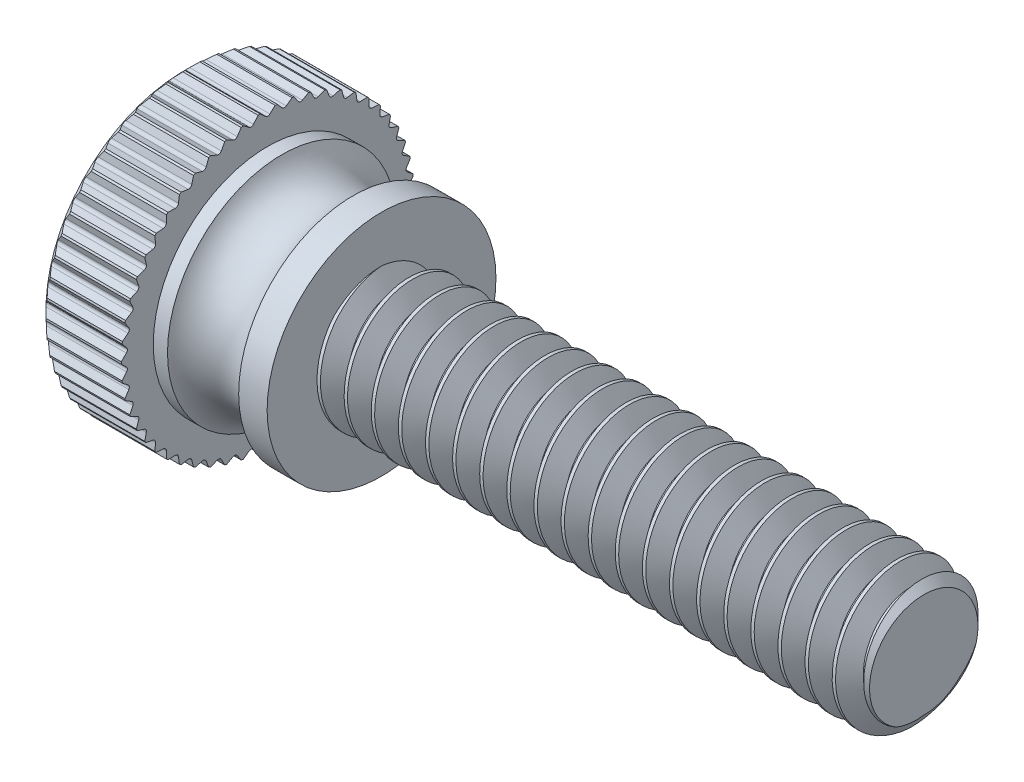
from build123d import *

# Parameters (mm, degrees)
CHAMFER1_SIZE      = 0.635
CHAMFER2_SIZE      = 0.41148
CUT_SWEEP1_PITCH   = 1.27
CUT_SWEEP1_TO      = 25.4
CUT_EXTRUDE1_DEPTH = 9.271
CIRPATTERN1_COUNT  = 54


with BuildPart() as part:
    # Sketch3 → Revolve1 (revolve)
    with BuildSketch(Plane.XY, mode=Mode.PRIVATE) as revolve1_sk:
        with BuildLine():
            Line((-9.271, 0), (-9.271, 6.858))
            Line((-9.271, 6.858), (-5.334, 6.858))
            Line((-5.334, 6.858), (-5.334, 5.3594))
            Line((-5.334, 5.3594), (-4.66725, 5.3594))
            ThreePointArc((-4.66725, 5.3594), (-3.000375, 4.28752), (-1.3335, 5.3594))
            Line((-1.3335, 5.3594), (0, 5.3594))
            Line((0, 5.3594), (0, 3.175))
            Line((0, 3.175), (25.4, 3.175))
            Line((25.4, 3.175), (25.4, 0))
            Line((25.4, 0), (-9.271, 0))
        make_face()
    revolve(revolve1_sk.sketch.rotate(Axis((0, 0, 0), (1, 0, 0)), 90), axis=Axis((0, 0, 0), (1, 0, 0)))

    # Chamfer1
    chamfer1_edges = [part.edges().sort_by_distance(p)[0] for p in [
        (25.4, 0, -3.175),
    ]]
    chamfer(chamfer1_edges, length=CHAMFER1_SIZE)

    # Chamfer2
    chamfer2_edges = [part.edges().sort_by_distance(p)[0] for p in [
        (-9.271, 0, -6.858),
    ]]
    chamfer(chamfer2_edges, length=CHAMFER2_SIZE)


with BuildPart() as body_2:
    # Split1: the piece on the far side of the plane
    add(part.part)
    split(bisect_by=Plane(origin=(0, 0, 0), x_dir=(0, 0, 1), z_dir=(1, 0, 0)), keep=Keep.BOTTOM)


with BuildPart() as part_1:
    add(part.part)

    # Split1
    split(bisect_by=Plane(origin=(0, 0, 0), x_dir=(0, 0, 1), z_dir=(1, 0, 0)), keep=Keep.TOP)

    # Cut-Sweep1: arcs per turn and ends read off the stored shape
    # Cut-Sweep1: the profile of Sketch5 screwed along a right-hand helix through 21 turns, 8 arcs to a turn; built about Z, then put on its axis
    cut_sweep1_z = Axis((0, 0, 0), (0, 0, 1))
    cut_sweep1_corners = [(3.243740766, 0, 0.0396875), (3.243740766, 0, -1.1509375), (2.350110803, 0, -0.635), (2.350110803, 0, -0.47625)]
    with BuildLine(mode=Mode.PRIVATE) as cut_sweep1_profile:
        Line(cut_sweep1_corners[0], cut_sweep1_corners[1])
        Line(cut_sweep1_corners[1], cut_sweep1_corners[2])
        Line(cut_sweep1_corners[2], cut_sweep1_corners[3])
        Line(cut_sweep1_corners[3], cut_sweep1_corners[0])
    cut_sweep1_cap = Face(cut_sweep1_profile.wire())
    cut_sweep1_turn_angles = [0, 22.5, 45, 67.5, 90, 112.5, 135, 157.5, 180, 202.5, 225, 247.5, 270, 292.5, 315, 337.5, 360]
    cut_sweep1_turn_weights = [1, 0.9238795325112867, 1, 0.9238795325112867, 1, 0.9238795325112867, 1, 0.9238795325112867, 1, 0.9238795325112867, 1, 0.9238795325112867, 1, 0.9238795325112867, 1, 0.9238795325112867, 1]
    cut_sweep1_turn_rails = [Edge.make_bspline([Vector(p[0], p[1], 0).rotate(cut_sweep1_z, cut_sweep1_turn_angles[k]) / cut_sweep1_turn_weights[k] + Vector(0, 0, p[2] + CUT_SWEEP1_PITCH * cut_sweep1_turn_angles[k] / 360) for k in range(17)], [0, 0, 0, 1, 1, 2, 2, 3, 3, 4, 4, 5, 5, 6, 6, 7, 7, 8, 8, 8], 2, cut_sweep1_turn_weights) for p in cut_sweep1_corners]
    cut_sweep1_turn_sides = [Face.make_surface_from_curves(cut_sweep1_turn_rails[p[0]], cut_sweep1_turn_rails[p[1]]) for p in [(0, 1), (1, 2), (2, 3), (3, 0)]]
    cut_sweep1 = Plane(origin=(25.4, 0, 0), x_dir=(0, 1, 0), z_dir=(-1, 0, 0)) * split(Solid(Shell([*[p.moved(Location((0, 0, CUT_SWEEP1_PITCH * i))) for i in range(21) for p in cut_sweep1_turn_sides], cut_sweep1_cap, cut_sweep1_cap.rotate(cut_sweep1_z, 7560).moved(Location((0, 0, CUT_SWEEP1_PITCH * 7560 / 360)))])), bisect_by=Plane.XY.offset(CUT_SWEEP1_TO), keep=Keep.BOTTOM, mode=Mode.PRIVATE)
    add(cut_sweep1, mode=Mode.SUBTRACT)

    add(body_2.part)  # Boss-Extrude1 merges body 2
    # Boss-Extrude1 cone 1 section (through the dimple's axis) → Boss-Extrude1 (revolve)
    with BuildSketch(Plane(origin=(0, 0, 0), x_dir=(0, 0, -1), z_dir=(0, 1, 0))):
        Polygon((0, 0), (3.175, 0), (0, 1.833087105), align=None)
    revolve(axis=Axis((0, 0, 0), (-1, 0, 0)))

    # Sketch7 → Cut-Extrude1 (cut)
    with BuildSketch(Plane.ZY.offset(9.271)):
        with BuildLine():
            Line((-0.637405357, 7.112), (0.637405357, 7.112))
            Line((0.637405357, 7.112), (0.10287, 6.623598943))
            ThreePointArc((0.10287, 6.623598943), (0, 6.58368), (-0.10287, 6.623598943))
            Line((-0.10287, 6.623598943), (-0.637405357, 7.112))
        make_face()
    cut_extrude1 = extrude(amount=-CUT_EXTRUDE1_DEPTH, mode=Mode.SUBTRACT)

    # CirPattern1: Cut-Extrude1 ×54 about axis
    cirpattern1_axis = Axis((0, 0, 0), (1, 0, 0))
    for i in range(1, CIRPATTERN1_COUNT):
        add(cut_extrude1.rotate(cirpattern1_axis, i * 360 / CIRPATTERN1_COUNT), mode=Mode.SUBTRACT)


solid = part_1.part
